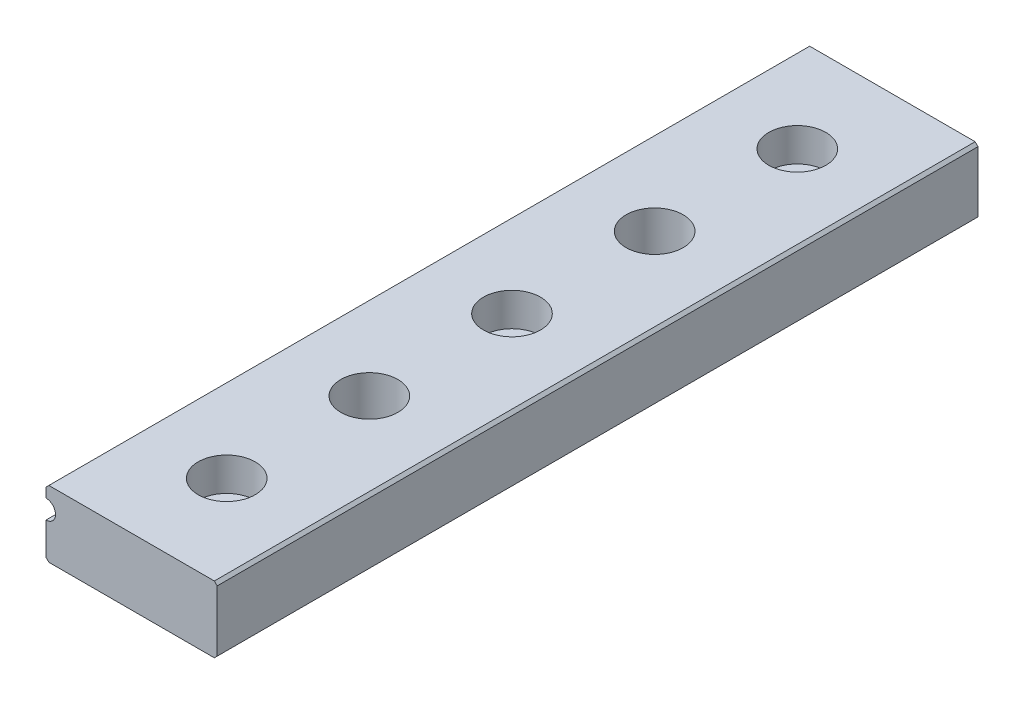
from build123d import *

# Parameters (mm, degrees)
ESBO_O1_W                                            = 18
ESBO_O1_H                                            = 80
RESSALTO_EXTRUS_O1_DEPTH                             = 3.5
FURO_DE_DI_METRO_2_0_2_1_D                           = 2
FURO_DE_DI_METRO_6_0_6_1_D                           = 6
REBAIXO_PARA_PARAFUSO_DE_M_QUINA_DE_CABE_D           = 3.5
REBAIXO_PARA_PARAFUSO_DE_M_QUINA_DE_CABE_CBORE_D     = 6
REBAIXO_PARA_PARAFUSO_DE_M_QUINA_DE_CABE_CBORE_DEPTH = 3.5
PADR_O_LINEAR1_COUNT                                 = 2
PADR_O_LINEAR1_PITCH                                 = 30
PADR_O_LINEAR2_COUNT                                 = 3
PADR_O_LINEAR2_PITCH                                 = 30
CHANFRO1_SIZE                                        = 0.3


with BuildPart() as part:
    # Esboço1 → Ressalto-extrusão1 (new, symmetric)
    with BuildSketch(Plane.XZ):
        Rectangle(ESBO_O1_W, ESBO_O1_H)
    extrude(amount=RESSALTO_EXTRUS_O1_DEPTH, both=True)

    # Furo de diâmetro Ø2.0 (2)1 (through all)
    with Locations(Plane(origin=(0, 0, -40), x_dir=(-1, 0, 0), z_dir=(0, 0, -1))):
        with Locations((-7.733780064, 7.831787449), (9, 1.2)):
            Hole(FURO_DE_DI_METRO_2_0_2_1_D / 2)

    # Furo de diâmetro Ø6.0 (6)1 (through all)
    with Locations(Plane(origin=(0, 3.5, 0), x_dir=(1, 0, 0), z_dir=(0, 1, 0))):
        with Locations((0, -15)):
            furo_de_di_metro_6_0_6_1 = Hole(FURO_DE_DI_METRO_6_0_6_1_D / 2)

    # Rebaixo para parafuso de máquina de cabeça sextavada de M31 (through all)
    with Locations(Plane(origin=(0, 3.5, 0), x_dir=(1, 0, 0), z_dir=(0, 1, 0))):
        with Locations((0, -30)):
            rebaixo_para_parafuso_de_m_quina_de_cabe = CounterBoreHole(REBAIXO_PARA_PARAFUSO_DE_M_QUINA_DE_CABE_D / 2, REBAIXO_PARA_PARAFUSO_DE_M_QUINA_DE_CABE_CBORE_D / 2, REBAIXO_PARA_PARAFUSO_DE_M_QUINA_DE_CABE_CBORE_DEPTH)

    # Padrão linear1: Furo de diâmetro Ø6.0 (6)1 ×2
    with Locations(*[(0, 0, -i * PADR_O_LINEAR1_PITCH) for i in range(1, PADR_O_LINEAR1_COUNT)]):
        add(furo_de_di_metro_6_0_6_1, mode=Mode.SUBTRACT)

    # Padrão linear2: Rebaixo para parafuso de máquina de cabeça sextavada de M31 ×3
    with Locations(*[(0, 0, -i * PADR_O_LINEAR2_PITCH) for i in range(1, PADR_O_LINEAR2_COUNT)]):
        add(rebaixo_para_parafuso_de_m_quina_de_cabe, mode=Mode.SUBTRACT)

    # Chanfro1
    chanfro1_edges = [part.edges().sort_by_distance(p)[0] for p in [
        (-9, 3.5, 0),
        (9, 3.5, 0),
        (9, -3.5, 0),
        (-9, -3.5, 0),
    ]]
    chamfer(chanfro1_edges, length=CHANFRO1_SIZE)


solid = part.part
